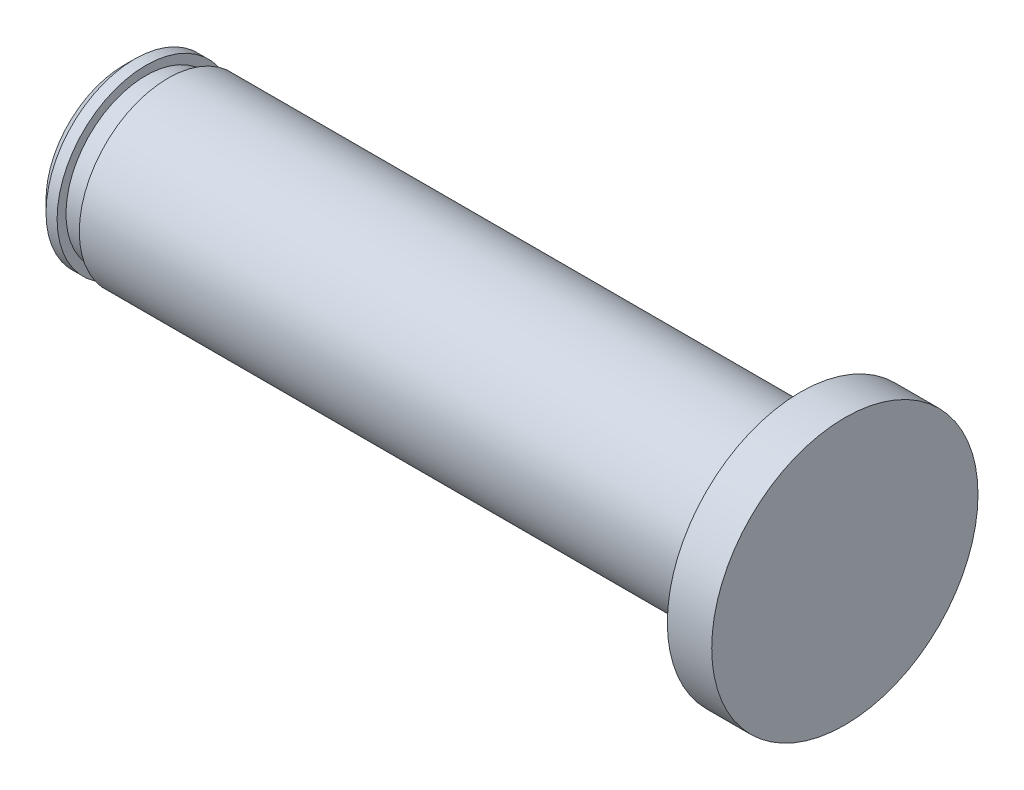
from build123d import *

# Parameters (mm, degrees)
CHAMFER_1_SIZE = 0.5


with BuildPart() as part:
    # Эскиз1 → Повернуть1 (revolve)
    with BuildSketch(Plane.XY):
        Polygon((0, 0), (-32.5, 0), (-32.5, 4), (-31.5, 4), (-31.5, 3.6), (-30.5, 3.6), (-30.5, 4), (-2, 4), (-2, 6), (0, 6), align=None)
    revolve(axis=Axis((-32.5, 0, 0), (1, 0, 0)))

    # Фаска1
    chamfer_1_edges = [part.edges().sort_by_distance(p)[0] for p in [
        (-32.5, -4, 0),
    ]]
    chamfer(chamfer_1_edges, length=CHAMFER_1_SIZE)


solid = part.part
